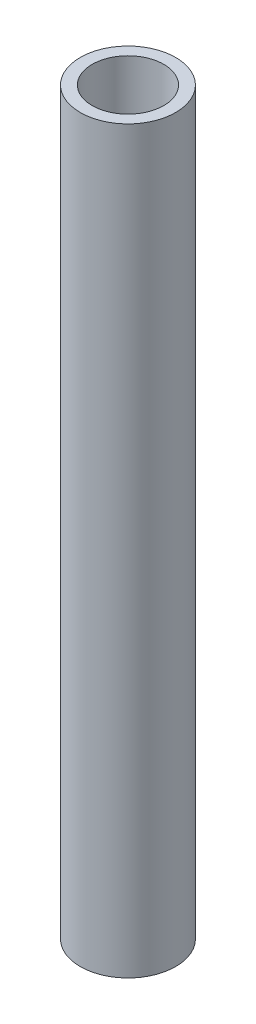
from build123d import *

# Parameters (mm, degrees)
SKETCH2_R           = 12.7
SKETCH2_R_2         = 9.525
BOSS_EXTRUDE1_DEPTH = 196.85


with BuildPart() as part:
    # Sketch2 → Boss-Extrude1 (new body)
    with BuildSketch(Plane(origin=(0, 0, 0), x_dir=(1, 0, 0), z_dir=(0, 1, 0))):
        with Locations((-14.567556118, 0)):
            Circle(SKETCH2_R)
        with Locations((-14.567556118, 0)):
            Circle(SKETCH2_R_2, mode=Mode.SUBTRACT)
    extrude(amount=BOSS_EXTRUDE1_DEPTH)


solid = part.part
